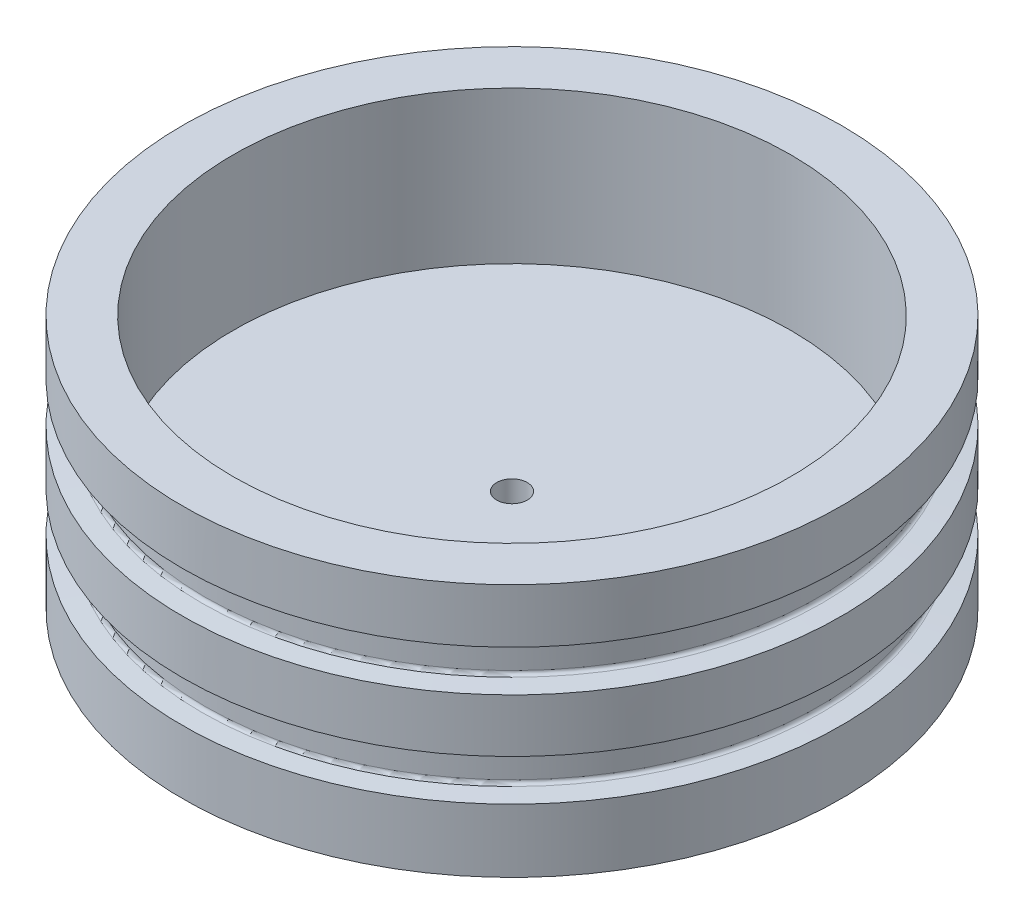
from build123d import *

# Parameters (mm, degrees)
LPATTERN1_COUNT = 2
LPATTERN1_PITCH = 11.853333333


with BuildPart() as part:
    # Sketch1 → Revolve1 (revolve)
    with BuildSketch(Plane.XY):
        Polygon((-41.275, 13.97), (-41.275, 45.72), (-34.925, 45.72), (-34.925, 26.67), (-1.913255, 26.67), (-1.913255, 0), (-5.1435, 0), (-5.1435, 13.97), align=None)
    revolve(axis=Axis((0, 0, 0), (0, 1, 0)))

    # Sketch7 → Groove for AS 568-234, O-Ring1 (revolve, cut)
    with BuildSketch(Plane(origin=(0, 0, 0), x_dir=(0, 0, -1), z_dir=(-1, 0, 0))):
        with BuildLine():
            Line((38.861359272, -33.977922723), (41.3639, -33.758978779))
            Line((41.3639, -33.758978779), (41.3639, -38.946666667))
            Line((41.3639, -38.946666667), (38.861359272, -38.727722723))
            ThreePointArc((38.861359272, -38.727722723), (38.572380224, -38.585214027), (38.4556, -38.28491418))
            Line((38.4556, -38.28491418), (38.4556, -34.420731266))
            ThreePointArc((38.4556, -34.420731266), (38.572380224, -34.120431419), (38.861359272, -33.977922723))
        make_face()
    groove_for_as_568_234_o_ring1 = revolve(axis=Axis((0, -50, 0), (0, 1, 0)), mode=Mode.SUBTRACT)

    # LPattern1: Groove for AS 568-234, O-Ring1 ×2
    with Locations(*[(0, -i * LPATTERN1_PITCH, 0) for i in range(1, LPATTERN1_COUNT)]):
        add(groove_for_as_568_234_o_ring1, mode=Mode.SUBTRACT)


solid = part.part
